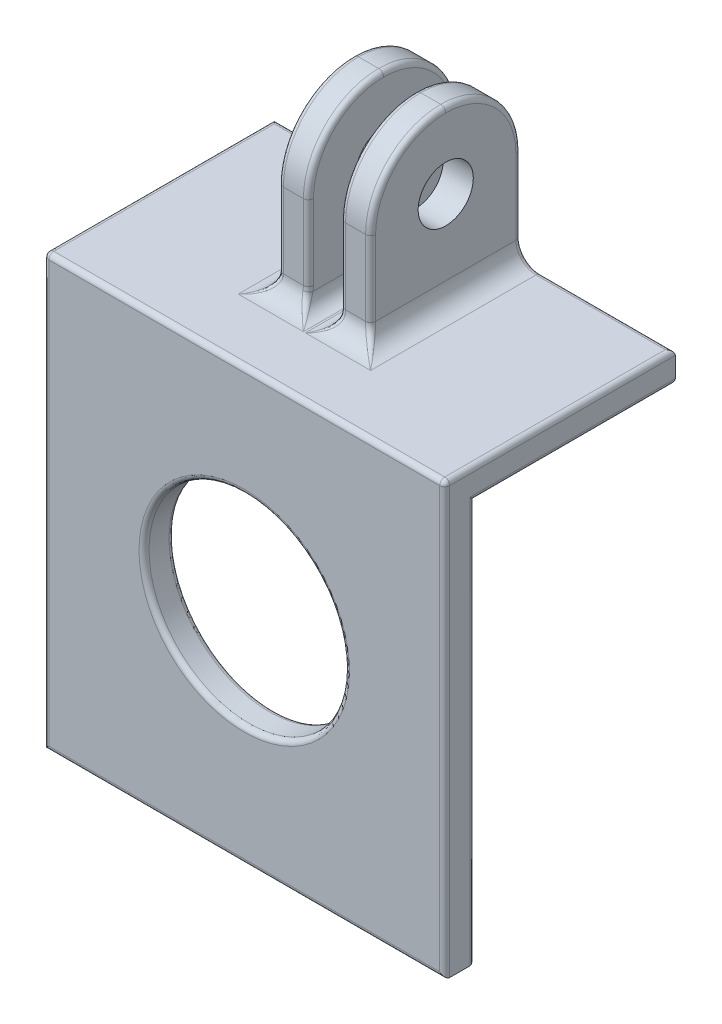
from build123d import *

# Parameters (mm, degrees)
AUFSATZ_LINEAR_AUSTRAGEN1_DEPTH = 20
SKIZZE2_W                       = 3
SKIZZE2_H                       = 15
AUFSATZ_LINEAR_AUSTRAGEN2_DEPTH = 17
VERRUNDUNG1_R                   = 7.5
SKIZZE3_R                       = 2.75
SCHNITT_LINEAR_AUSTRAGEN1_DEPTH = 49.018459992
VERRUNDUNG2_R                   = 2
VERRUNDUNG3_R                   = 1.5
VERRUNDUNG4_R                   = 0.5
SKIZZE4_R                       = 10
SCHNITT_LINEAR_AUSTRAGEN2_DEPTH = 49.752461476
VERRUNDUNG5_R                   = 0.5


with BuildPart() as part:
    # Skizze1 → Aufsatz-Linear austragen1 (new, symmetric)
    with BuildSketch(Plane(origin=(0, 0, 0), x_dir=(0, 0, -1), z_dir=(1, 0, 0))):
        Polygon((7.1, 21.05), (-15.9, 21.05), (-15.9, -21.95), (-12.9, -21.95), (-12.9, 18.05), (7.1, 18.05), align=None)
    extrude(amount=AUFSATZ_LINEAR_AUSTRAGEN1_DEPTH, both=True)

    # Skizze2 → Aufsatz-Linear austragen2 (add)
    with BuildSketch(Plane(origin=(0, 21.05, 0), x_dir=(1, 0, 0), z_dir=(0, 1, 0))):
        with Locations((-3.1, -0.4)):
            Rectangle(SKIZZE2_W, SKIZZE2_H)
        with Locations((3.1, -0.4)):
            Rectangle(SKIZZE2_W, SKIZZE2_H)
    extrude(amount=AUFSATZ_LINEAR_AUSTRAGEN2_DEPTH)

    # Verrundung1
    verrundung1_edges = [part.edges().sort_by_distance(p)[0] for p in [
        (3.1, 38.05, -7.1),
        (-3.1, 38.05, -7.1),
        (3.1, 38.05, 7.9),
        (-3.1, 38.05, 7.9),
    ]]
    fillet(verrundung1_edges, radius=VERRUNDUNG1_R - 0.0001)  # a hair under: the kernel refuses the full size

    # Skizze3 → Schnitt-Linear austragen1 (cut, through all)
    with BuildSketch(Plane(origin=(4.6, 0, 0), x_dir=(0, 0, -1), z_dir=(1, 0, 0))):
        with Locations((-0.4, 30.55)):
            Circle(SKIZZE3_R)
    extrude(amount=-SCHNITT_LINEAR_AUSTRAGEN1_DEPTH, mode=Mode.SUBTRACT)

    # Verrundung2
    verrundung2_edges = [part.edges().sort_by_distance(p)[0] for p in [
        (-4.6, 21.05, 0.4),
        (-3.1, 21.05, 7.9),
        (3.1, 21.05, 7.9),
        (4.6, 21.05, 0.4),
    ]]
    fillet(verrundung2_edges, radius=VERRUNDUNG2_R)

    # Verrundung3
    verrundung3_edges = [part.edges().sort_by_distance(p)[0] for p in [
        (-1.6, 21.05, 1.4),
        (1.6, 21.05, 1.4),
    ]]
    fillet(verrundung3_edges, radius=VERRUNDUNG3_R)

    # Verrundung4
    verrundung4_edges = [part.edges().sort_by_distance(p)[0] for p in [
        (5.307902185, 21.523407966, 8.607902185),
        (1.6, 22.797991415, 7.915940607),
        (0, 21.05, -7.1),
        (0, 18.05, -7.1),
        (1.067090536, 21.40338068, 8.764815088),
        (1.160660172, 21.489339828, -7.1),
        (-1.160660172, 21.489339828, -7.1),
        (0, -21.95, 12.9),
        (-1.067090539, 21.403380676, 8.764815088),
        (0, -21.95, 15.9),
        (0, 21.05, 15.9),
        (13.3, 21.05, -7.1),
        (20, -0.45, 15.9),
        (20, -1.95, 12.9),
        (20, 18.05, 2.9),
        (1.6, 26.80005, 7.9),
        (1.6, 26.55005, -7.1),
        (1.6, 35.853330148, 5.703330148),
        (1.6, 35.853330148, -4.903330148),
        (-4.6, 26.80005, -7.1),
        (-1.6, 26.55005, -7.1),
        (4.6, 26.80005, -7.1),
        (4.6, 26.80005, 7.9),
        (4.6, 35.853330148, 5.703330148),
        (4.6, 35.853330148, -4.903330148),
        (-4.6, 26.80005, 7.9),
        (-4.6, 35.853330148, 5.703330148),
        (-4.6, 35.853330148, -4.903330148),
        (-1.6, 26.80005, 7.9),
        (-1.6, 35.853330148, 5.703330148),
        (-1.6, 35.853330148, -4.903330148),
        (-20, 18.05, 2.9),
        (-20, -1.95, 12.9),
        (-13.3, 21.05, -7.1),
        (-20, -0.45, 15.9),
        (-5.185786438, 21.635786438, -7.1),
        (-20, 21.05, 4.4),
        (-1.6, 22.797991415, 7.915940607),
        (5.185786438, 21.635786438, -7.1),
        (20, 21.05, 4.4),
        (-5.307902124, 21.523408018, 8.607902124),
    ]]
    fillet(verrundung4_edges, radius=VERRUNDUNG4_R)

    # Skizze4 → Schnitt-Linear austragen2 (cut, through all)
    with BuildSketch(Plane.XY.offset(15.9)):
        Circle(SKIZZE4_R)
    extrude(amount=-SCHNITT_LINEAR_AUSTRAGEN2_DEPTH, mode=Mode.SUBTRACT)

    # Verrundung5
    verrundung5_edges = [part.edges().sort_by_distance(p)[0] for p in [
        (-10, 0, 12.9),
        (-10, 0, 15.9),
    ]]
    fillet(verrundung5_edges, radius=VERRUNDUNG5_R)


solid = part.part
